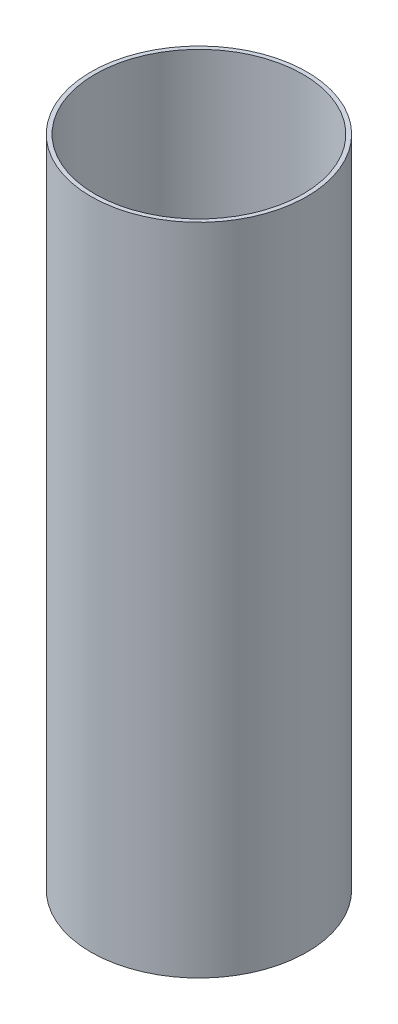
from build123d import *

# Parameters (mm, degrees)
SKETCH1_R           = 39.6
SKETCH1_R_2         = 38.1
BOSS_EXTRUDE1_DEPTH = 240


with BuildPart() as part:
    # Sketch1 → Boss-Extrude1 (new body)
    with BuildSketch(Plane(origin=(0, 0, 0), x_dir=(1, 0, 0), z_dir=(0, 1, 0))):
        Circle(SKETCH1_R)
        Circle(SKETCH1_R_2, mode=Mode.SUBTRACT)
    extrude(amount=BOSS_EXTRUDE1_DEPTH)


solid = part.part
